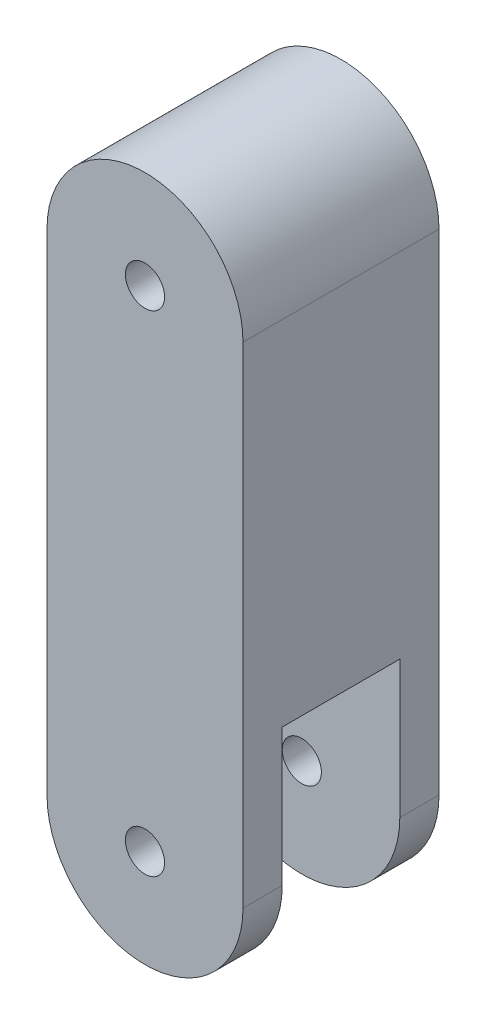
from build123d import *

# Parameters (mm, degrees)
CROQUIS1_R              = 0.5
SALIENTE_EXTRUIR2_DEPTH = 5
CROQUIS3_W              = 3
CROQUIS3_H              = 6.621183209
CORTAR_EXTRUIR2_DEPTH   = 5


with BuildPart() as part:
    # Croquis1 → Saliente-Extruir2 (new body)
    with BuildSketch(Plane.XY):
        with BuildLine():
            ThreePointArc((2.5, 0), (0, 2.5), (-2.5, 0))
            Line((-2.5, 0), (-2.5, -12.5))
            ThreePointArc((-2.5, -12.5), (0, -15), (2.5, -12.5))
            Line((2.5, -12.5), (2.5, 0))
        make_face()
        with Locations((0, -12.5)):
            Circle(CROQUIS1_R, mode=Mode.SUBTRACT)
        Circle(CROQUIS1_R, mode=Mode.SUBTRACT)
    extrude(amount=SALIENTE_EXTRUIR2_DEPTH)

    # Croquis3 → Cortar-Extruir2 (cut)
    with BuildSketch(Plane(origin=(2.5, 0, 0), x_dir=(0, 0, -1), z_dir=(1, 0, 0))):
        with Locations((-2.5, -12.310591605)):
            Rectangle(CROQUIS3_W, CROQUIS3_H)
    extrude(amount=-CORTAR_EXTRUIR2_DEPTH, mode=Mode.SUBTRACT)


solid = part.part
